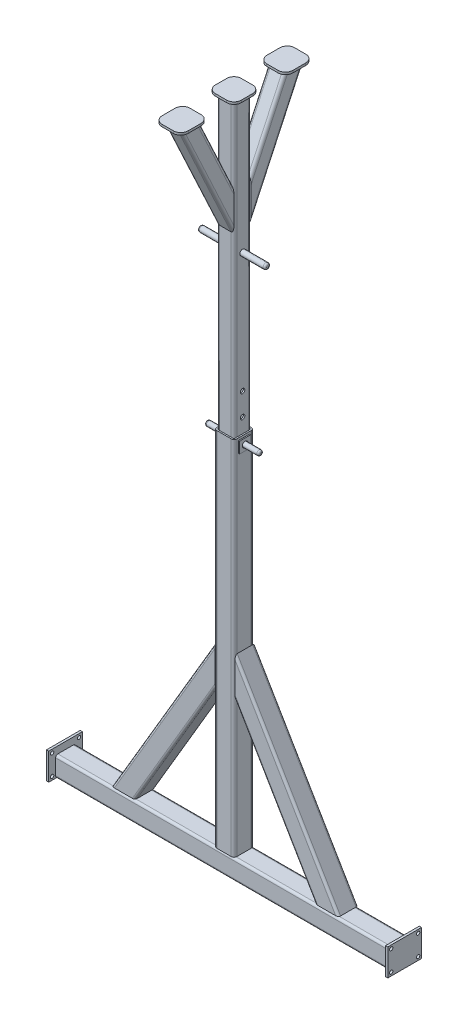
from build123d import *

# Parameters (mm, degrees)
BOTTOM_START                      = -750
BOTTOM_CROSS_MEMBER_DEPTH         = 1500
LOWER_UPRIGHT_DEPTH               = 1700
SKETCH18_W                        = 150
SKETCH18_H                        = 120
SKETCH18_R                        = 7.5
FRONT_END_PLATE_DEPTH             = 10
SKETCH19_W                        = 150
SKETCH19_H                        = 120
SKETCH19_R                        = 7.5
REAR_END_PLATE_DEPTH              = 10
FRONT_START                       = -253.510063282
FRONT_SUPPORT_DEPTH               = 986.154146166
REAR_START                        = -732.644082884
REAR_SUPPORT_DEPTH                = 986.154146166
SKETCH112_W                       = 50
SKETCH112_H                       = 50
FRONT_PIN_PLATE_DEPTH             = 5
SKETCH125_W                       = 50
SKETCH125_H                       = 50
REAR_PIN_PLATE_DEPTH              = 5
PIN_CUT_DEPTH                     = 1885.36575603
PIN_CUT_DEPTH_BACK                = 1885.36575603
SKETCH113_R                       = 12.5
UPPER_START                       = 1300
UPPER_SUPPORT_DEPTH               = 1700
TOP_PLATE_DEPTH                   = 10
OUTER_START                       = 2265.769467592
OUTER_DIAGONAL_DEPTH              = 551.688959481
BODY_START                        = 2817.458427033
BODY_11_RUN_ON_DEPTH              = 17.766322
OUTER_DIAGONAL_PLATE_DEPTH        = 10
SKETCH119_R                       = 10
PIN_CUTIN_UPPER_DEPTH             = 912
PIN_CUTIN_UPPER_DIRECTION_2_REACH = 3129.971
PIN_HOLE_PATTERN_COUNT            = 3
PIN_HOLE_PATTERN_PITCH            = 100
LOCKING_PIN_DEPTH                 = 120
LOCKING_PIN_DEPTH_BACK            = 120
SKETCH120_R                       = 11
SKETCH122_R                       = 12.5
LIFTING_HANDLE_DEPTH              = 150
FILLET1_R                         = 8
FILLET2_R                         = 8


# Read off the part's stored shape, not the designer's step: Bottom Cross Member, Lower Upright, Front Support, Rear Support, Upper Support, Outer Diagonal
with BuildPart() as part:
    # Bottom Cross Member outline → Bottom Cross Member (new body)
    with BuildSketch(Plane.YZ.offset(BOTTOM_START)):
        with BuildLine():
            ThreePointArc((78.9, -44.45), (85.971067812, -41.521067812), (88.9, -34.45))
            Line((88.9, -34.45), (88.9, 34.45))
            ThreePointArc((88.9, 34.45), (85.971067812, 41.521067812), (78.9, 44.45))
            Line((78.9, 44.45), (10, 44.45))
            ThreePointArc((10, 44.45), (2.928932188, 41.521067812), (0, 34.45))
            Line((0, 34.45), (0, -34.45))
            ThreePointArc((0, -34.45), (2.928932188, -41.521067812), (10, -44.45))
            Line((10, -44.45), (78.9, -44.45))
        make_face()
        with BuildLine():
            Line((10, 39.45), (78.9, 39.45))
            ThreePointArc((78.9, 39.45), (82.435533906, 37.985533906), (83.9, 34.45))
            Line((83.9, 34.45), (83.9, -34.45))
            ThreePointArc((83.9, -34.45), (82.435533906, -37.985533906), (78.9, -39.45))
            Line((78.9, -39.45), (10, -39.45))
            ThreePointArc((10, -39.45), (6.464466094, -37.985533906), (5, -34.45))
            Line((5, -34.45), (5, 34.45))
            ThreePointArc((5, 34.45), (6.464466094, 37.985533906), (10, 39.45))
        make_face(mode=Mode.SUBTRACT)
    extrude(amount=BOTTOM_CROSS_MEMBER_DEPTH)


with BuildPart() as body_2:
    # Lower Upright outline → Lower Upright (new body)
    with BuildSketch(Plane(origin=(0, 0, 0), x_dir=(1, 0, 0), z_dir=(0, 1, 0))):
        with BuildLine():
            Line((-31.75, -44.45), (31.75, -44.45))
            ThreePointArc((31.75, -44.45), (40.730256121, -40.730256121), (44.45, -31.75))
            Line((44.45, -31.75), (44.45, 31.75))
            ThreePointArc((44.45, 31.75), (40.730256121, 40.730256121), (31.75, 44.45))
            Line((31.75, 44.45), (-31.75, 44.45))
            ThreePointArc((-31.75, 44.45), (-40.730256121, 40.730256121), (-44.45, 31.75))
            Line((-44.45, 31.75), (-44.45, -31.75))
            ThreePointArc((-44.45, -31.75), (-40.730256121, -40.730256121), (-31.75, -44.45))
        make_face()
        with BuildLine():
            Line((38.1, 31.75), (38.1, -31.75))
            ThreePointArc((38.1, -31.75), (36.240128061, -36.240128061), (31.75, -38.1))
            Line((31.75, -38.1), (-31.75, -38.1))
            ThreePointArc((-31.75, -38.1), (-36.240128061, -36.240128061), (-38.1, -31.75))
            Line((-38.1, -31.75), (-38.1, 31.75))
            ThreePointArc((-38.1, 31.75), (-36.240128061, 36.240128061), (-31.75, 38.1))
            Line((-31.75, 38.1), (31.75, 38.1))
            ThreePointArc((31.75, 38.1), (36.240128061, 36.240128061), (38.1, 31.75))
        make_face(mode=Mode.SUBTRACT)
    extrude(amount=LOWER_UPRIGHT_DEPTH)

    # Lower Upright Trim
    split(bisect_by=Plane(origin=(0, 88.9, 0), x_dir=(-1, 0, 0), z_dir=(0, 1, 0)), keep=Keep.TOP)


with BuildPart() as body_3:
    # Sketch18 → Front End Plate (new body)
    with BuildSketch(Plane.ZY.offset(750)):
        with Locations((0, 60)):
            Rectangle(SKETCH18_W, SKETCH18_H)
        with Locations(Location((60, 105, 0), (0, 0, 270))):
            Circle(SKETCH18_R, mode=Mode.SUBTRACT)
        with Locations(Location((60, 15, 0), (0, 0, 270))):
            Circle(SKETCH18_R, mode=Mode.SUBTRACT)
        with Locations(Location((-60, 15, 0), (0, 0, 270))):
            Circle(SKETCH18_R, mode=Mode.SUBTRACT)
        with Locations(Location((-60, 105, 0), (0, 0, 270))):
            Circle(SKETCH18_R, mode=Mode.SUBTRACT)
    extrude(amount=FRONT_END_PLATE_DEPTH)


with BuildPart() as body_4:
    # Sketch19 → Rear End Plate (new body)
    with BuildSketch(Plane(origin=(750, 0, 0), x_dir=(0, 0, -1), z_dir=(1, 0, 0))):
        with Locations((0, 60)):
            Rectangle(SKETCH19_W, SKETCH19_H)
        with Locations(Location((-60, 15, 0), (0, 0, 90))):
            Circle(SKETCH19_R, mode=Mode.SUBTRACT)
        with Locations(Location((60, 15, 0), (0, 0, 90))):
            Circle(SKETCH19_R, mode=Mode.SUBTRACT)
        with Locations(Location((60, 105, 0), (0, 0, 90))):
            Circle(SKETCH19_R, mode=Mode.SUBTRACT)
        with Locations(Location((-60, 105, 0), (0, 0, 90))):
            Circle(SKETCH19_R, mode=Mode.SUBTRACT)
    extrude(amount=REAR_END_PLATE_DEPTH)


with BuildPart() as body_5:
    # Front Support outline → Front Support (new body)
    with BuildSketch(Plane(origin=(0, 0, 0), x_dir=(0.8619342151577696, -0.5070201265633938, 0), z_dir=(0.5070201265633938, 0.8619342151577696, 0)).offset(FRONT_START)):
        with BuildLine():
            ThreePointArc((-479.867107579, -30), (-476.938175391, -37.071067812), (-469.867107579, -40))
            Line((-469.867107579, -40), (-400.967107579, -40))
            ThreePointArc((-400.967107579, -40), (-393.896039767, -37.071067812), (-390.967107579, -30))
            Line((-390.967107579, -30), (-390.967107579, 38.9))
            ThreePointArc((-390.967107579, 38.9), (-393.896039767, 45.971067812), (-400.967107579, 48.9))
            Line((-400.967107579, 48.9), (-469.867107579, 48.9))
            ThreePointArc((-469.867107579, 48.9), (-476.938175391, 45.971067812), (-479.867107579, 38.9))
            Line((-479.867107579, 38.9), (-479.867107579, -30))
        make_face()
        with BuildLine():
            Line((-395.967107579, 38.9), (-395.967107579, -30))
            ThreePointArc((-395.967107579, -30), (-397.431573673, -33.535533906), (-400.967107579, -35))
            Line((-400.967107579, -35), (-469.867107579, -35))
            ThreePointArc((-469.867107579, -35), (-473.402641485, -33.535533906), (-474.867107579, -30))
            Line((-474.867107579, -30), (-474.867107579, 38.9))
            ThreePointArc((-474.867107579, 38.9), (-473.402641485, 42.435533906), (-469.867107579, 43.9))
            Line((-469.867107579, 43.9), (-400.967107579, 43.9))
            ThreePointArc((-400.967107579, 43.9), (-397.431573673, 42.435533906), (-395.967107579, 38.9))
        make_face(mode=Mode.SUBTRACT)
    extrude(amount=FRONT_SUPPORT_DEPTH)

    # Front Trim
    split(bisect_by=Plane(origin=(-44.45, 894.45, 0), x_dir=(0, -1, 0), z_dir=(-1, 0, 0)), keep=Keep.TOP)

    # Front Trim 3
    split(bisect_by=Plane(origin=(0, 88.9, 0), x_dir=(-1, 0, 0), z_dir=(0, 1, 0)), keep=Keep.TOP)


with BuildPart() as body_6:
    # Rear Support outline → Rear Support (new body)
    with BuildSketch(Plane(origin=(0, 0, 0), x_dir=(0.8619342151577696, 0.5070201265633938, 0), z_dir=(0.5070201265633938, -0.8619342151577696, 0)).offset(REAR_START)):
        with BuildLine():
            Line((469.867107579, 40), (400.967107579, 40))
            ThreePointArc((400.967107579, 40), (393.896039767, 37.071067812), (390.967107579, 30))
            Line((390.967107579, 30), (390.967107579, -38.9))
            ThreePointArc((390.967107579, -38.9), (393.896039767, -45.971067812), (400.967107579, -48.9))
            Line((400.967107579, -48.9), (469.867107579, -48.9))
            ThreePointArc((469.867107579, -48.9), (476.938175391, -45.971067812), (479.867107579, -38.9))
            Line((479.867107579, -38.9), (479.867107579, 30))
            ThreePointArc((479.867107579, 30), (476.938175391, 37.071067812), (469.867107579, 40))
        make_face()
        with BuildLine():
            ThreePointArc((395.967107579, 30), (397.431573673, 33.535533906), (400.967107579, 35))
            Line((400.967107579, 35), (469.867107579, 35))
            ThreePointArc((469.867107579, 35), (473.402641485, 33.535533906), (474.867107579, 30))
            Line((474.867107579, 30), (474.867107579, -38.9))
            ThreePointArc((474.867107579, -38.9), (473.402641485, -42.435533906), (469.867107579, -43.9))
            Line((469.867107579, -43.9), (400.967107579, -43.9))
            ThreePointArc((400.967107579, -43.9), (397.431573673, -42.435533906), (395.967107579, -38.9))
            Line((395.967107579, -38.9), (395.967107579, 30))
        make_face(mode=Mode.SUBTRACT)
    extrude(amount=REAR_SUPPORT_DEPTH)

    # Rear Trim
    split(bisect_by=Plane(origin=(0, 88.9, 0), x_dir=(-1, 0, 0), z_dir=(0, 1, 0)), keep=Keep.TOP)

    # Rear Trim 3
    split(bisect_by=Plane(origin=(44.45, 894.45, 0), x_dir=(0, 1, 0), z_dir=(1, 0, 0)), keep=Keep.TOP)


with BuildPart() as body_7:
    # Sketch112 → Front Pin Plate (new body)
    with BuildSketch(Plane.ZY.offset(44.45)):
        with Locations((0, 1665)):
            Rectangle(SKETCH112_W, SKETCH112_H)
    extrude(amount=FRONT_PIN_PLATE_DEPTH)


with BuildPart() as body_8:
    # Sketch125 → Rear Pin Plate (new body)
    with BuildSketch(Plane(origin=(44.45, 0, 0), x_dir=(0, 0, -1), z_dir=(1, 0, 0))):
        with Locations((0, 1665)):
            Rectangle(SKETCH125_W, SKETCH125_H)
    extrude(amount=REAR_PIN_PLATE_DEPTH)


with BuildPart() as pin_cut_tool:
    # Sketch113 → Pin Cut (new, two sides: drawn at the far end of the back side and taken through both)
    with BuildSketch(Plane(origin=(-49.45, 0, 0), x_dir=(0, 0, -1), z_dir=(1, 0, 0)).offset(-PIN_CUT_DEPTH_BACK)):
        with Locations((0, 1665)):
            Circle(SKETCH113_R)
    extrude(amount=PIN_CUT_DEPTH + PIN_CUT_DEPTH_BACK)


with BuildPart() as body_2_1:
    add(body_2.part)

    # Pin Cut: cut by pin_cut_tool
    add(pin_cut_tool.part, mode=Mode.SUBTRACT)


with BuildPart() as body_7_1:
    add(body_7.part)

    # Pin Cut: cut by pin_cut_tool
    add(pin_cut_tool.part, mode=Mode.SUBTRACT)


with BuildPart() as body_8_1:
    add(body_8.part)

    # Pin Cut: cut by pin_cut_tool
    add(pin_cut_tool.part, mode=Mode.SUBTRACT)


with BuildPart() as body_9:
    # Upper Support outline → Upper Support (new body)
    with BuildSketch(Plane(origin=(0, 0, 0), x_dir=(1, 0, 0), z_dir=(0, 1, 0)).offset(UPPER_START)):
        with BuildLine():
            ThreePointArc((25.4, -38.1), (34.380256121, -34.380256121), (38.1, -25.4))
            Line((38.1, -25.4), (38.1, 25.4))
            ThreePointArc((38.1, 25.4), (34.380256121, 34.380256121), (25.4, 38.1))
            Line((25.4, 38.1), (-25.4, 38.1))
            ThreePointArc((-25.4, 38.1), (-34.380256121, 34.380256121), (-38.1, 25.4))
            Line((-38.1, 25.4), (-38.1, -25.4))
            ThreePointArc((-38.1, -25.4), (-34.380256121, -34.380256121), (-25.4, -38.1))
            Line((-25.4, -38.1), (25.4, -38.1))
        make_face()
        with BuildLine():
            Line((-25.4, 31.75), (25.4, 31.75))
            ThreePointArc((25.4, 31.75), (29.890128061, 29.890128061), (31.75, 25.4))
            Line((31.75, 25.4), (31.75, -25.4))
            ThreePointArc((31.75, -25.4), (29.890128061, -29.890128061), (25.4, -31.75))
            Line((25.4, -31.75), (-25.4, -31.75))
            ThreePointArc((-25.4, -31.75), (-29.890128061, -29.890128061), (-31.75, -25.4))
            Line((-31.75, -25.4), (-31.75, 25.4))
            ThreePointArc((-31.75, 25.4), (-29.890128061, 29.890128061), (-25.4, 31.75))
        make_face(mode=Mode.SUBTRACT)
    extrude(amount=UPPER_SUPPORT_DEPTH)

    # Sketch119 → Pin CutIn Upper (cut)
    with BuildSketch(Plane.ZY.offset(38.1)):
        with Locations(Location((0, 1665, 0), (0, 0, 180))):
            Circle(SKETCH119_R)
    pin_cutin_upper = extrude(amount=PIN_CUTIN_UPPER_DEPTH, mode=Mode.SUBTRACT)

    # Pin CutIn Upper direction 2: up to this face of the body (flat: up to its plane)
    pin_cutin_upper_direction_2_end = Plane(body_9.part.faces().sort_by_distance((38.1, 2150, 0))[0])
    # Sketch119 → Pin CutIn Upper direction 2 (cut, up to the picked face)
    with BuildSketch(Plane.ZY.offset(38.1), mode=Mode.PRIVATE) as pin_cutin_upper_direction_2_sk1:
        with Locations(Location((0, 1665, 0), (0, 0, 180))):
            Circle(SKETCH119_R)
    pin_cutin_upper_direction_2_tool1 = split(extrude(pin_cutin_upper_direction_2_sk1.sketch, amount=-PIN_CUTIN_UPPER_DIRECTION_2_REACH, mode=Mode.PRIVATE), bisect_by=pin_cutin_upper_direction_2_end, keep=Keep.BOTH, mode=Mode.PRIVATE)
    pin_cutin_upper_direction_2 = pin_cutin_upper_direction_2_tool1.solids().sort_by(Axis((-38.1, 1665, 0), (1, 0, 0)))[0]
    add(pin_cutin_upper_direction_2, mode=Mode.SUBTRACT)

    # Pin Hole Pattern: Pin CutIn Upper, Pin CutIn Upper direction 2 ×3
    with Locations(*[(0, i * PIN_HOLE_PATTERN_PITCH, 0) for i in range(1, PIN_HOLE_PATTERN_COUNT)]):
        add(pin_cutin_upper, mode=Mode.SUBTRACT)
        add(pin_cutin_upper_direction_2, mode=Mode.SUBTRACT)


with BuildPart() as body_10:
    # Sketch116 → Top Plate (new body)
    with BuildSketch(Plane(origin=(0, 3000, 0), x_dir=(1, 0, 0), z_dir=(0, 1, 0))):
        with BuildLine():
            Line((58.1, -25.4), (58.1, 25.4))
            ThreePointArc((58.1, 25.4), (48.522391745, 48.522391745), (25.4, 58.1))
            Line((25.4, 58.1), (-25.4, 58.1))
            ThreePointArc((-25.4, 58.1), (-48.522391745, 48.522391745), (-58.1, 25.4))
            Line((-58.1, 25.4), (-58.1, -25.4))
            ThreePointArc((-58.1, -25.4), (-48.522391745, -48.522391745), (-25.4, -58.1))
            Line((-25.4, -58.1), (25.4, -58.1))
            ThreePointArc((25.4, -58.1), (48.522391745, -48.522391745), (58.1, -25.4))
        make_face()
    extrude(amount=TOP_PLATE_DEPTH)


with BuildPart() as body_11:
    # Outer Diagonal outline → Outer Diagonal (new body)
    with BuildSketch(Plane(origin=(0, 0, 0), x_dir=(1, 0, 0), z_dir=(0, 0.9063077870366493, -0.4226182617407011)).offset(OUTER_START)):
        with BuildLine():
            Line((38.1, -1081.945654352), (38.1, -1031.145654352))
            ThreePointArc((38.1, -1031.145654352), (34.380256121, -1022.165398231), (25.4, -1018.445654352))
            Line((25.4, -1018.445654352), (-25.4, -1018.445654352))
            ThreePointArc((-25.4, -1018.445654352), (-34.380256121, -1022.165398231), (-38.1, -1031.145654352))
            Line((-38.1, -1031.145654352), (-38.1, -1081.945654352))
            ThreePointArc((-38.1, -1081.945654352), (-34.380256121, -1090.925910473), (-25.4, -1094.645654352))
            Line((-25.4, -1094.645654352), (25.4, -1094.645654352))
            ThreePointArc((25.4, -1094.645654352), (34.380256121, -1090.925910473), (38.1, -1081.945654352))
        make_face()
        with BuildLine():
            ThreePointArc((25.4, -1024.795654352), (29.890128061, -1026.655526291), (31.75, -1031.145654352))
            Line((31.75, -1031.145654352), (31.75, -1081.945654352))
            ThreePointArc((31.75, -1081.945654352), (29.89012806, -1086.435782412), (25.4, -1088.295654352))
            Line((25.4, -1088.295654352), (-25.4, -1088.295654352))
            ThreePointArc((-25.4, -1088.295654352), (-29.89012806, -1086.435782412), (-31.75, -1081.945654352))
            Line((-31.75, -1081.945654352), (-31.75, -1031.145654352))
            ThreePointArc((-31.75, -1031.145654352), (-29.890128061, -1026.655526291), (-25.4, -1024.795654352))
            Line((-25.4, -1024.795654352), (25.4, -1024.795654352))
        make_face(mode=Mode.SUBTRACT)
    extrude(amount=OUTER_DIAGONAL_DEPTH)

    # Outer Diagonal outline → body 11 run on (add)
    with BuildSketch(Plane(origin=(0, 0, 0), x_dir=(1, 0, 0), z_dir=(0, 0.9063077870366493, -0.4226182617407011)).offset(BODY_START)):
        with BuildLine():
            Line((38.1, -1081.945654352), (38.1, -1031.145654352))
            ThreePointArc((38.1, -1031.145654352), (34.380256121, -1022.165398231), (25.4, -1018.445654352))
            Line((25.4, -1018.445654352), (-25.4, -1018.445654352))
            ThreePointArc((-25.4, -1018.445654352), (-34.380256121, -1022.165398231), (-38.1, -1031.145654352))
            Line((-38.1, -1031.145654352), (-38.1, -1081.945654352))
            ThreePointArc((-38.1, -1081.945654352), (-34.380256121, -1090.925910473), (-25.4, -1094.645654352))
            Line((-25.4, -1094.645654352), (25.4, -1094.645654352))
            ThreePointArc((25.4, -1094.645654352), (34.380256121, -1090.925910473), (38.1, -1081.945654352))
        make_face()
        with BuildLine():
            ThreePointArc((25.4, -1024.795654352), (29.890128061, -1026.655526291), (31.75, -1031.145654352))
            Line((31.75, -1031.145654352), (31.75, -1081.945654352))
            ThreePointArc((31.75, -1081.945654352), (29.89012806, -1086.435782412), (25.4, -1088.295654352))
            Line((25.4, -1088.295654352), (-25.4, -1088.295654352))
            ThreePointArc((-25.4, -1088.295654352), (-29.89012806, -1086.435782412), (-31.75, -1081.945654352))
            Line((-31.75, -1081.945654352), (-31.75, -1031.145654352))
            ThreePointArc((-31.75, -1031.145654352), (-29.890128061, -1026.655526291), (-25.4, -1024.795654352))
            Line((-25.4, -1024.795654352), (25.4, -1024.795654352))
        make_face(mode=Mode.SUBTRACT)
    extrude(amount=BODY_11_RUN_ON_DEPTH)

    # Trim/Extend2
    split(bisect_by=Plane(origin=(0, 2150, -38.1), x_dir=(0, 1, 0), z_dir=(0, 0, -1)), keep=Keep.TOP)

    # Trim_Extend2 4
    split(bisect_by=Plane.XZ.offset(-3000), keep=Keep.TOP)


with BuildPart() as body_12:
    # Sketch126 → Outer Diagonal Plate (new body)
    with BuildSketch(Plane(origin=(0, 3000, 0), x_dir=(1, 0, 0), z_dir=(0, 1, 0))):
        with BuildLine():
            Line((58.1, 205.128029936), (58.1, 261.179628219))
            add(Edge.make_bspline(
                [(58.1, 261.179628219), (58.1, 263.382198724), (57.896737872, 265.550418927), (57.298030547, 268.753096088), (57.049142394, 269.812320465), (56.600069346, 271.388357205), (56.437732883, 271.911565766), (56.087191603, 272.953611264), (55.899228851, 273.471488837), (54.904579525, 276.022737563), (53.928187199, 277.963318276), (52.193537367, 280.724088819), (51.570006078, 281.619159697), (50.563897596, 282.92240884), (50.215936098, 283.351056864), (49.503645159, 284.185744702), (49.138583397, 284.59282118), (47.26925235, 286.577510337), (45.634179499, 288.004497869), (43.412051235, 289.582927975), (42.958631152, 289.888256578), (42.033369814, 290.477701121), (41.560172013, 290.762534354), (40.127359438, 291.575833097), (39.152008853, 292.06521647), (36.166870339, 293.378432499), (34.098598879, 294.048912809), (31.41107553, 294.619071798), (30.868049837, 294.719556459), (29.781765213, 294.891310537), (29.237263958, 294.962873469), (27.599700953, 295.134805182), (26.50259049, 295.19252779), (25.4, 295.19252779)],
                knots=[0, 0, 0, 0, 0.125, 0.125, 0.1875, 0.1875, 0.21875, 0.21875, 0.25, 0.25, 0.375, 0.375, 0.4375, 0.4375, 0.46875, 0.46875, 0.5, 0.5, 0.625, 0.625, 0.65625, 0.65625, 0.6875, 0.6875, 0.75, 0.75, 0.875, 0.875, 0.90625, 0.90625, 0.9375, 0.9375, 1, 1, 1, 1], degree=3))
            Line((25.4, 295.19252779), (-25.4, 295.19252779))
            add(Edge.make_bspline(
                [(-25.4, 295.19252779), (-27.603486281, 295.19252779), (-29.76775096, 294.96377643), (-32.9579342, 294.292794908), (-34.011886405, 294.014064803), (-35.578328231, 293.511480424), (-36.099366264, 293.329293949), (-37.125767268, 292.940334024), (-37.632042535, 292.733347161), (-40.129543733, 291.637234714), (-42.020127216, 290.566349949), (-44.696946753, 288.672769935), (-45.566318192, 287.989553298), (-47.217366679, 286.553011821), (-48.002355466, 285.798001585), (-49.493810658, 284.21681199), (-50.200270417, 283.390626607), (-51.201245419, 282.098132252), (-51.525100741, 281.658415796), (-52.153026608, 280.761050859), (-52.457822975, 280.302224359), (-53.921936105, 277.978020609), (-54.898374069, 276.033662919), (-56.085529127, 272.996080047), (-56.434654182, 271.963228423), (-56.887298605, 270.382961958), (-57.026576774, 269.849834546), (-57.279199847, 268.7809012), (-57.39269192, 268.244828111), (-57.89697386, 265.556545735), (-58.1, 263.380807649), (-58.1, 261.179628219)],
                knots=[0, 0, 0, 0, 0.125, 0.125, 0.1875, 0.1875, 0.21875, 0.21875, 0.25, 0.25, 0.375, 0.375, 0.4375, 0.4375, 0.5, 0.5, 0.5625, 0.5625, 0.59375, 0.59375, 0.625, 0.625, 0.75, 0.75, 0.8125, 0.8125, 0.84375, 0.84375, 0.875, 0.875, 1, 1, 1, 1], degree=3))
            Line((-58.1, 261.179628219), (-58.1, 205.128029936))
            add(Edge.make_bspline(
                [(-58.1, 205.128029936), (-58.1, 202.925459431), (-57.896737872, 200.757239228), (-57.298030547, 197.554562067), (-57.049142394, 196.49533769), (-56.600069346, 194.91930095), (-56.437732883, 194.396092389), (-56.087191603, 193.354046891), (-55.899228851, 192.836169318), (-54.904579525, 190.284920592), (-53.928187199, 188.344339879), (-52.193537367, 185.583569336), (-51.570006078, 184.688498458), (-50.563897596, 183.385249315), (-50.215936098, 182.956601291), (-49.503645159, 182.121913453), (-49.138583397, 181.714836975), (-47.26925235, 179.730147818), (-45.634179499, 178.303160286), (-43.412051235, 176.72473018), (-42.958631152, 176.419401577), (-42.033369814, 175.829957034), (-41.560172013, 175.545123801), (-40.127359438, 174.731825058), (-39.152008853, 174.242441685), (-36.166870339, 172.929225656), (-34.098598879, 172.258745346), (-31.41107553, 171.688586357), (-30.868049837, 171.588101696), (-29.781765213, 171.416347618), (-29.237263958, 171.344784686), (-27.599700953, 171.172852973), (-26.50259049, 171.115130365), (-25.4, 171.115130365)],
                knots=[0, 0, 0, 0, 0.125, 0.125, 0.1875, 0.1875, 0.21875, 0.21875, 0.25, 0.25, 0.375, 0.375, 0.4375, 0.4375, 0.46875, 0.46875, 0.5, 0.5, 0.625, 0.625, 0.65625, 0.65625, 0.6875, 0.6875, 0.75, 0.75, 0.875, 0.875, 0.90625, 0.90625, 0.9375, 0.9375, 1, 1, 1, 1], degree=3))
            Line((-25.4, 171.115130365), (25.4, 171.115130365))
            add(Edge.make_bspline(
                [(25.4, 171.115130365), (27.603486281, 171.115130365), (29.76775096, 171.343881725), (32.9579342, 172.014863247), (34.011886405, 172.293593352), (35.578328231, 172.796177731), (36.099366264, 172.978364206), (37.125767268, 173.367324131), (37.632042535, 173.574310994), (40.129543733, 174.670423441), (42.020127216, 175.741308206), (44.696946753, 177.63488822), (45.566318192, 178.318104857), (47.217366679, 179.754646334), (48.002355466, 180.50965657), (49.493810658, 182.090846165), (50.200270417, 182.917031548), (51.201245419, 184.209525903), (51.525100741, 184.649242359), (52.153026608, 185.546607296), (52.457822975, 186.005433796), (53.921936105, 188.329637546), (54.898374069, 190.273995236), (56.085529127, 193.311578108), (56.434654182, 194.344429732), (56.887298605, 195.924696197), (57.026576774, 196.457823609), (57.279199847, 197.526756955), (57.39269192, 198.062830044), (57.89697386, 200.75111242), (58.1, 202.926850506), (58.1, 205.128029936)],
                knots=[0, 0, 0, 0, 0.125, 0.125, 0.1875, 0.1875, 0.21875, 0.21875, 0.25, 0.25, 0.375, 0.375, 0.4375, 0.4375, 0.5, 0.5, 0.5625, 0.5625, 0.59375, 0.59375, 0.625, 0.625, 0.75, 0.75, 0.8125, 0.8125, 0.84375, 0.84375, 0.875, 0.875, 1, 1, 1, 1], degree=3))
        make_face()
    extrude(amount=OUTER_DIAGONAL_PLATE_DEPTH)


with BuildPart() as body_13:
    # Inner Diagonal: mirrored copy
    add(body_11.part.mirror(Plane.XY))


with BuildPart() as body_14:
    # Inner Diagonal 2: mirrored copy
    add(body_12.part.mirror(Plane.XY))


with BuildPart() as body_15:
    # Sketch120 → Locking Pin (new, two sides: drawn at the far end of the back side and taken through both)
    with BuildSketch(Plane(origin=(0, 0, 0), x_dir=(0, 0, -1), z_dir=(1, 0, 0)).offset(-LOCKING_PIN_DEPTH_BACK)):
        with Locations((0, 1665)):
            Circle(SKETCH120_R)
    extrude(amount=LOCKING_PIN_DEPTH + LOCKING_PIN_DEPTH_BACK)

    # Fillet1
    fillet1_edges = [body_15.edges().sort_by_distance(p)[0] for p in [
        (-120, 1665, 11),
        (120, 1665, 11),
    ]]
    fillet(fillet1_edges, radius=FILLET1_R)


with BuildPart() as body_16:
    # Sketch122 → Lifting Handle (new, symmetric)
    with BuildSketch(Plane.ZY):
        with Locations((0, 2400)):
            Circle(SKETCH122_R)
    extrude(amount=LIFTING_HANDLE_DEPTH, both=True)

    # Fillet2
    fillet2_edges = [body_16.edges().sort_by_distance(p)[0] for p in [
        (150, 2400, -12.5),
        (-150, 2400, -12.5),
    ]]
    fillet(fillet2_edges, radius=FILLET2_R)


solid = Compound([part.part, body_3.part, body_4.part, body_5.part, body_6.part, body_2_1.part, body_7_1.part, body_8_1.part, body_9.part, body_10.part, body_11.part, body_12.part, body_13.part, body_14.part, body_15.part, body_16.part])
